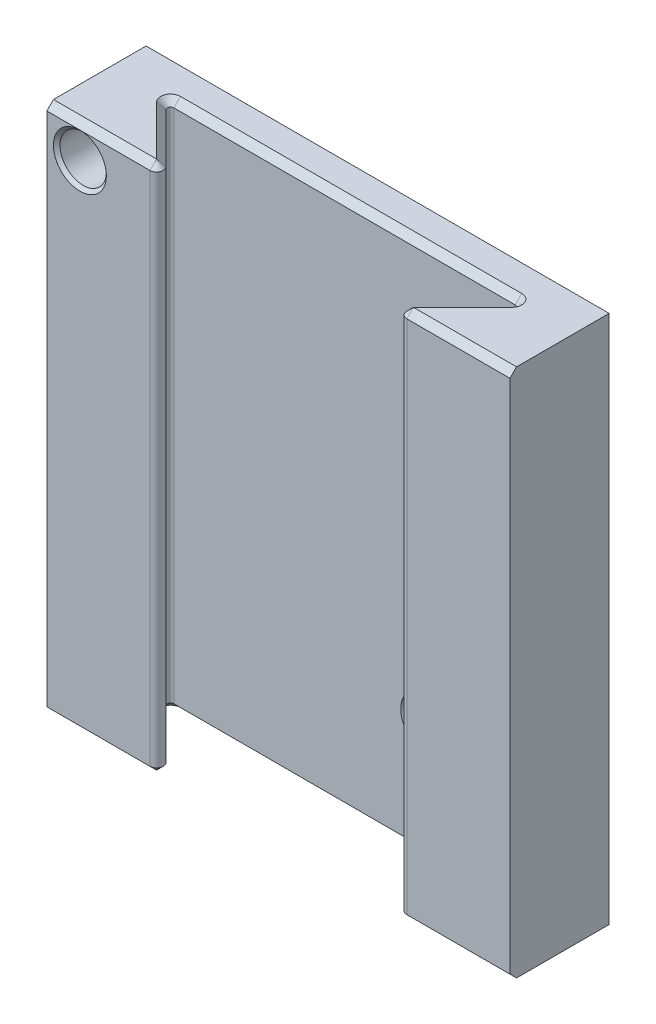
from build123d import *

# Parameters (mm, degrees)
SKETCH1_W               = 70
SKETCH1_H               = 80
BOSS_EXTRUDE1_DEPTH     = 15
CUT_EXTRUDE1_DEPTH      = 108.354552768
SKETCH3_R               = 3.5
CUT_EXTRUDE2_DEPTH      = 108.354552768
CUT_EXTRUDE3_DEPTH      = 107.77078252
CUT_EXTRUDE3_DEPTH_BACK = 107.77078252
SKETCH4_R               = 3.5
FILLET1_R               = 0.5
FILLET2_R               = 1
CHAMFER1_SIZE           = 1
CHAMFER2_SIZE           = 0.5


with BuildPart() as part:
    # Sketch1 → Boss-Extrude1 (new body)
    with BuildSketch(Plane.XY):
        with Locations((35, 40)):
            Rectangle(SKETCH1_W, SKETCH1_H)
    extrude(amount=BOSS_EXTRUDE1_DEPTH)

    # Sketch2 → Cut-Extrude1 (cut, through all)
    with BuildSketch(Plane.XZ):
        Polygon((18, 15), (8, 5), (62, 5), (52, 15), align=None)
    extrude(amount=-CUT_EXTRUDE1_DEPTH, mode=Mode.SUBTRACT)

    # Sketch3 → Cut-Extrude2 (cut, through all)
    with BuildSketch(Plane.XY.offset(15)):
        with Locations((5, 75)):
            Circle(SKETCH3_R)
    extrude(amount=-CUT_EXTRUDE2_DEPTH, mode=Mode.SUBTRACT)

    # Sketch4 → Cut-Extrude3 (cut, two sides: drawn at the far end of the back side and taken through both)
    with BuildSketch(Plane.XY.offset(5).offset(-CUT_EXTRUDE3_DEPTH_BACK)):
        with Locations((47.5, 17.5)):
            Circle(SKETCH4_R)
    extrude(amount=CUT_EXTRUDE3_DEPTH + CUT_EXTRUDE3_DEPTH_BACK, mode=Mode.SUBTRACT)

    # Fillet1
    # the kernel refuses this fillet: 0.5 mm, written as the material it adds along each edge
    with BuildSketch(Plane(origin=(62, 0, 5), x_dir=(-0.7071067811865527, 0, 0.7071067811865425), z_dir=(0, 1, 0))) as fillet1_piece_1:
        with BuildLine():
            CenterArc((FILLET1_R * 2.41421356237, -FILLET1_R), FILLET1_R, 90, 135)
            Line((FILLET1_R * 1.70710678119, -FILLET1_R * 1.70710678119), (0, 0))
            Line((0, 0), (FILLET1_R * 2.41421356237, 0))
        make_face()
    extrude(amount=80)
    with BuildSketch(Plane(origin=(8, 73.785008685, 5), x_dir=(1, 0, 0), z_dir=(0, 1, 0))) as fillet1_piece_2_section:
        with BuildLine():
            CenterArc((FILLET1_R * 2.41421356237, -FILLET1_R), FILLET1_R, 90, 135)
            Line((FILLET1_R * 1.70710678119, -FILLET1_R * 1.70710678119), (0, 0))
            Line((0, 0), (FILLET1_R * 2.41421356237, 0))
        make_face()
    fillet1_piece_2 = extrude(amount=6.214991315, mode=Mode.PRIVATE)
    fillet1_piece_2 = fillet1_piece_2 - Plane(origin=(5, 75, 5.232830095), x_dir=(1, 0, 0), z_dir=(0, 0, 1)) * Cylinder(3.5, 18, mode=Mode.PRIVATE)
    add(fillet1_piece_2)
    with BuildSketch(Plane(origin=(8, 0, 5), x_dir=(1, 0, 0), z_dir=(0, 1, 0))) as fillet1_piece_3_section:
        with BuildLine():
            CenterArc((FILLET1_R * 2.41421356237, -FILLET1_R), FILLET1_R, 90, 135)
            Line((FILLET1_R * 1.70710678119, -FILLET1_R * 1.70710678119), (0, 0))
            Line((0, 0), (FILLET1_R * 2.41421356237, 0))
        make_face()
    fillet1_piece_3 = extrude(amount=76.214991315, mode=Mode.PRIVATE)
    fillet1_piece_3 = fillet1_piece_3 - Plane(origin=(5, 75, 5.222265381), x_dir=(1, 0, 0), z_dir=(0, 0, 1)) * Cylinder(3.5, 158, mode=Mode.PRIVATE)
    add(fillet1_piece_3)

    # Fillet2
    fillet2_edges = [part.edges().sort_by_distance(p)[0] for p in [
        (18, 40, 15),
        (52, 40, 15),
    ]]
    fillet(fillet2_edges, radius=FILLET2_R)

    # Chamfer1
    chamfer1_edges = [part.edges().sort_by_distance(p)[0] for p in [
        (62.207106781, 80, 15),
        (57.426776695, 0, 9.573223305),
        (57.426776695, 80, 9.573223305),
        (35, 0, 5),
        (35, 80, 5),
        (61.254832985, 0, 5.308658284),
        (61.254832985, 80, 5.308658284),
        (8.745167015, 0, 5.308658284),
        (8.745167015, 80, 5.308658284),
        (62.207106781, 0, 15),
        (12.573223305, 0, 9.573223305),
        (16.50966597, 0, 14.382683432),
        (53.49033403, 0, 14.382683432),
        (7.792893219, 80, 15),
        (12.573223305, 80, 9.573223305),
        (16.50966597, 80, 14.382683432),
        (53.49033403, 80, 14.382683432),
        (7.792893219, 0, 15),
    ]]
    chamfer(chamfer1_edges, length=CHAMFER1_SIZE)

    # Chamfer2
    # the kernel refuses this chamfer: 0.5 mm, written as the material it takes off along each edge
    with BuildSketch(Plane(origin=(5, 75, 0), x_dir=(1, 0, 0), z_dir=(0, -1, 0))) as chamfer2_piece_1:
        Polygon((3.5, CHAMFER2_SIZE), (3.5 + CHAMFER2_SIZE, 0), (3.5, 0), align=None)
    revolve(axis=Axis((5, 75, 0), (0, 0, 1)), mode=Mode.SUBTRACT)
    with BuildSketch(Plane(origin=(5, 75, 15), x_dir=(1, 0, 0), z_dir=(0, -1, 0))) as chamfer2_piece_2:
        Polygon((3.5 + CHAMFER2_SIZE, 0), (3.5, -CHAMFER2_SIZE), (3.5, 0), align=None)
    revolve(axis=Axis((5, 75, 15), (0, 0, 1)), mode=Mode.SUBTRACT)
    with BuildSketch(Plane(origin=(47.5, 17.5, 0), x_dir=(1, 0, 0), z_dir=(0, -1, 0))) as chamfer2_piece_3:
        Polygon((3.5 + CHAMFER2_SIZE, 0), (3.5, CHAMFER2_SIZE), (3.5, 0), align=None)
    revolve(axis=Axis((47.5, 17.5, 0), (0, 0, 1)), mode=Mode.SUBTRACT)
    with BuildSketch(Plane(origin=(47.5, 17.5, 5), x_dir=(1, 0, 0), z_dir=(0, -1, 0))) as chamfer2_piece_4:
        Polygon((3.5 + CHAMFER2_SIZE, 0), (3.5, -CHAMFER2_SIZE), (3.5, 0), align=None)
    revolve(axis=Axis((47.5, 17.5, 5), (0, 0, 1)), mode=Mode.SUBTRACT)


solid = part.part
